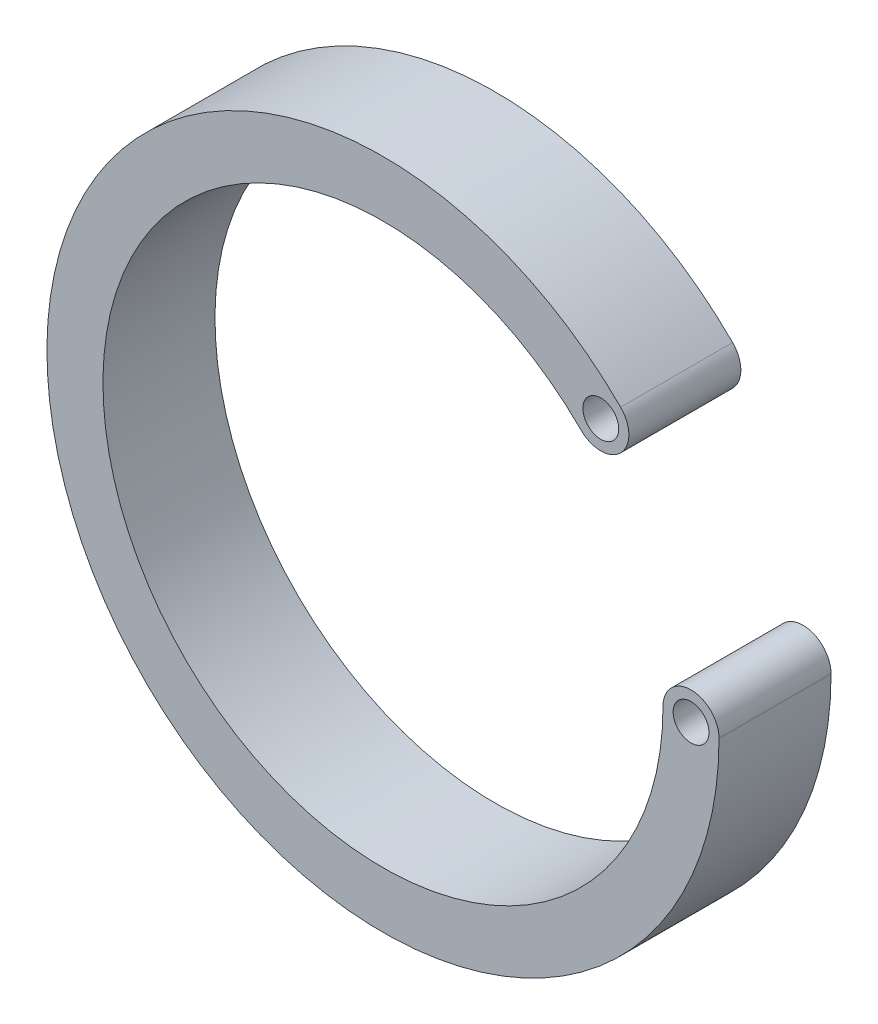
from build123d import *

# Parameters (mm, degrees)
SKETCH1_R           = 2.032
BOSS_EXTRUDE1_DEPTH = 12.7


with BuildPart() as part:
    # Sketch1 → Boss-Extrude1 (new body)
    with BuildSketch(Plane.XY):
        with BuildLine():
            ThreePointArc((31.75, 0), (-29.333175157, -12.150198978), (22.450640303, 22.450640303))
            ThreePointArc((22.450640303, 22.450640303), (26.940768363, 22.450640303), (26.940768363, 26.940768363))
            ThreePointArc((26.940768363, 26.940768363), (-35.199810189, -14.580238773), (38.1, 0))
            ThreePointArc((38.1, 0), (34.925, 3.175), (31.75, 0))
        make_face()
        with Locations((34.925, 0)):
            Circle(SKETCH1_R, mode=Mode.SUBTRACT)
        with Locations((24.695704333, 24.695704333)):
            Circle(SKETCH1_R, mode=Mode.SUBTRACT)
    extrude(amount=BOSS_EXTRUDE1_DEPTH)


solid = part.part
